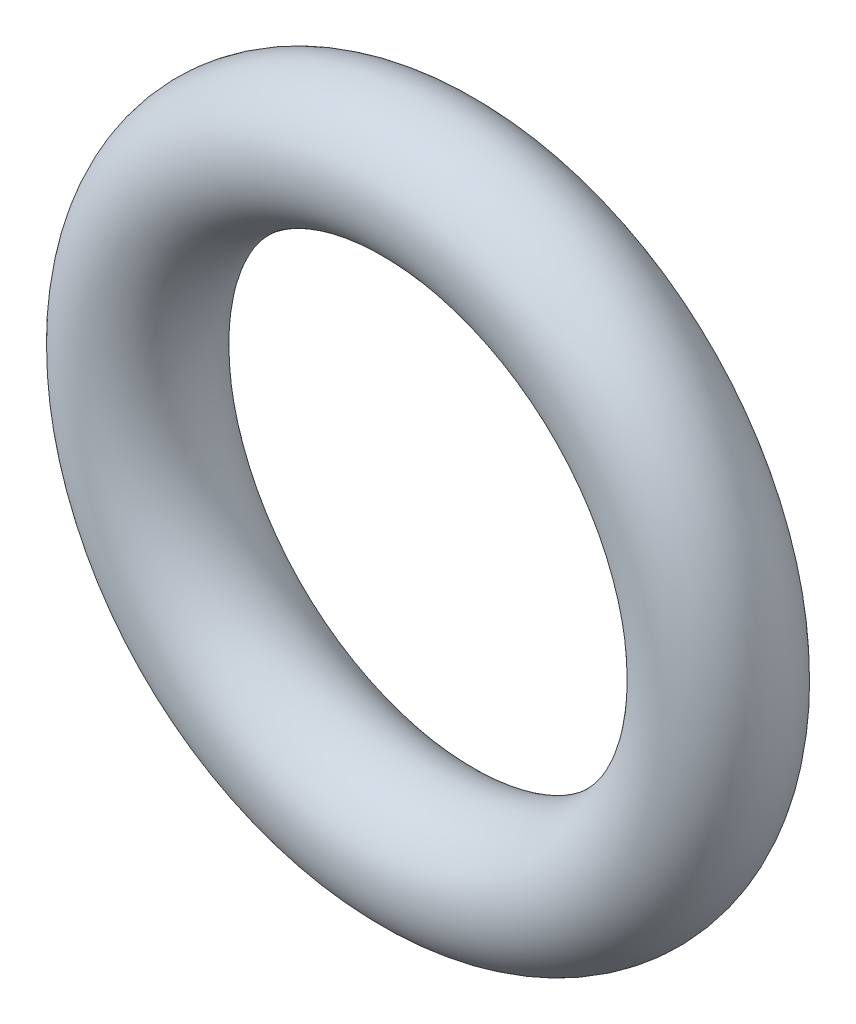
from build123d import *

# Parameters (mm, degrees)
O_RING_SKETCH_R = 0.5


with BuildPart() as part:
    # O-Ring Sketch → O-Ring Revolve (revolve)
    with BuildSketch(Plane(origin=(0, 0, 0), x_dir=(1, 0, 0), z_dir=(0, 1, 0))):
        with Locations((2.25, 0)):
            Circle(O_RING_SKETCH_R)
    revolve(axis=Axis((0, 0, 0), (0, 0, -1)))


solid = part.part
